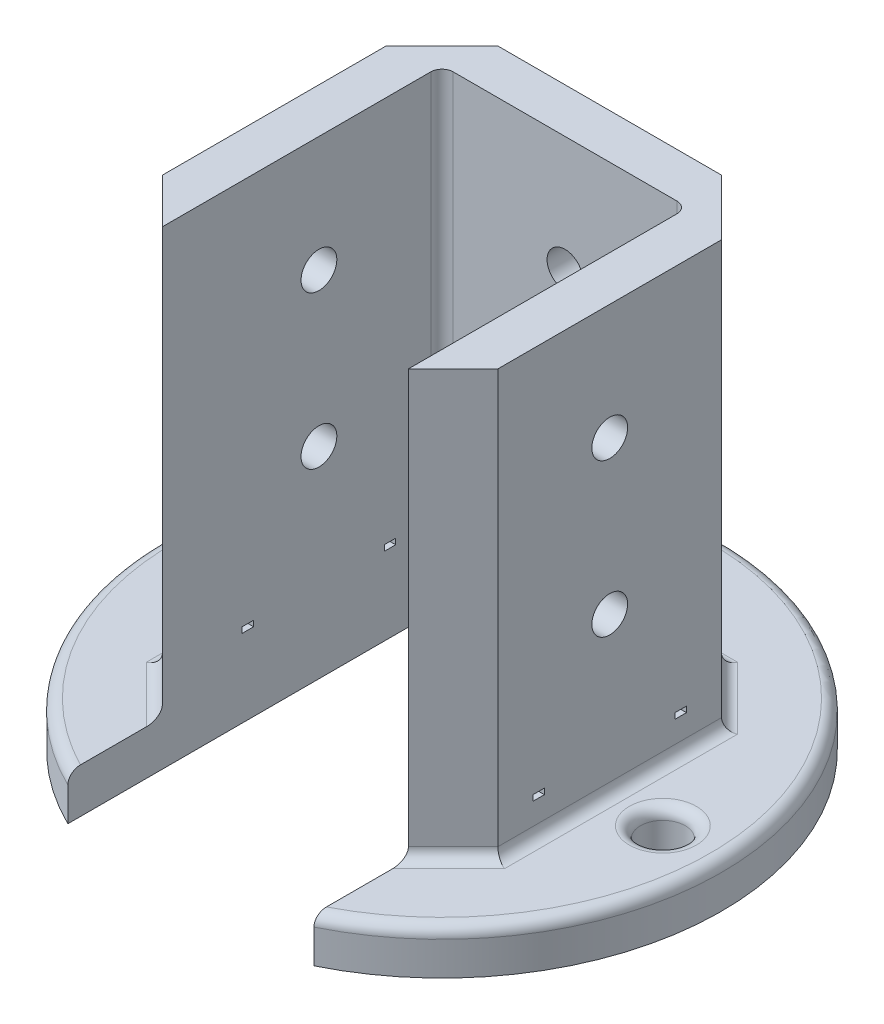
from build123d import *

# Parameters (mm, degrees)
SKETCH1_W               = 30
SKETCH1_H               = 30
BOSS_EXTRUDE1_DEPTH     = 62
SHELL1_T                = -4
SKETCH2_R               = 1.6
CUT_EXTRUDE1_DEPTH      = 62
SKETCH3_R               = 25
SKETCH3_R_2             = 2
SKETCH3_W               = 22
SKETCH3_H               = 22
BOSS_EXTRUDE2_DEPTH     = 4
CIRPATTERN1_COUNT       = 2
CIRPATTERN1_ANGLE       = 90
CHAMFER1_SIZE           = 5
FILLET1_R               = 1
FILLET2_R               = 1
SKETCH4_W               = 1.02
SKETCH4_H               = 0.51
CUT_EXTRUDE2_DEPTH      = 83.097503007
CIRPATTERN2_COUNT       = 2
CIRPATTERN2_ANGLE       = 90
SKETCH5_W               = 22
SKETCH5_H               = 14.914082391
CUT_EXTRUDE3_DEPTH      = 87.925255248
CUT_EXTRUDE4_DEPTH      = 84.928541203
CUT_EXTRUDE4_DEPTH_BACK = 84.928541203
SKETCH6_W               = 20
SKETCH6_H               = 15
SKETCH7_W               = 20
SKETCH7_H               = 15
CUT_EXTRUDE5_DEPTH      = 83.743569886
FILLET4_R               = 1
SKETCH8_W               = 39.694573315
SKETCH8_H               = 24
CUT_EXTRUDE6_DEPTH      = 84.928541203
FILLET5_R               = 1


with BuildPart() as part:
    # Sketch1 → Boss-Extrude1 (new body)
    with BuildSketch(Plane(origin=(0, 0, 0), x_dir=(1, 0, 0), z_dir=(0, 1, 0))):
        with Locations((15, 15)):
            Rectangle(SKETCH1_W, SKETCH1_H)
    extrude(amount=BOSS_EXTRUDE1_DEPTH)

    # Shell1
    shell1_openings = [part.faces().sort_by_distance(p)[0] for p in [
        (15, 62, -15),
        (15, 0, -15),
    ]]
    offset(amount=SHELL1_T, openings=shell1_openings, kind=Kind.INTERSECTION)

    # Sketch2 → Cut-Extrude1 (cut)
    with BuildSketch(Plane(origin=(30, 0, 0), x_dir=(0, 0, -1), z_dir=(1, 0, 0))):
        with Locations((15, 14)):
            Circle(SKETCH2_R)
        with Locations((15, 27.66)):
            Circle(SKETCH2_R)
    cut_extrude1 = extrude(amount=-CUT_EXTRUDE1_DEPTH, mode=Mode.SUBTRACT)

    # Sketch3 → Boss-Extrude2 (add)
    with BuildSketch(Plane.XZ):
        with Locations(Location((15, -15, 0), (0, 0, 270))):
            Circle(SKETCH3_R)
        with Locations(Location((34.75, -15, 0), (0, 0, 270))):
            Circle(SKETCH3_R_2, mode=Mode.SUBTRACT)
        with Locations(Location((15, -34.75, 0), (0, 0, 270))):
            Circle(SKETCH3_R_2, mode=Mode.SUBTRACT)
        with Locations(Location((-4.75, -15, 0), (0, 0, 270))):
            Circle(SKETCH3_R_2, mode=Mode.SUBTRACT)
        with Locations(Location((15, 4.75, 0), (0, 0, 270))):
            Circle(SKETCH3_R_2, mode=Mode.SUBTRACT)
        with Locations((15, -15)):
            Rectangle(SKETCH3_W, SKETCH3_H, mode=Mode.SUBTRACT)
    extrude(amount=BOSS_EXTRUDE2_DEPTH)

    # CirPattern1: Cut-Extrude1 ×2 about axis
    cirpattern1_axis = Axis((15, -4, -15), (0, 1, 0))
    for i in range(1, CIRPATTERN1_COUNT):
        add(cut_extrude1.rotate(cirpattern1_axis, i * CIRPATTERN1_ANGLE / (CIRPATTERN1_COUNT - 1)), mode=Mode.SUBTRACT)

    # Chamfer1
    chamfer1_edges = [part.edges().sort_by_distance(p)[0] for p in [
        (0, 31, -30),
        (30, 31, -30),
        (30, 31, 0),
        (0, 31, 0),
    ]]
    chamfer(chamfer1_edges, length=CHAMFER1_SIZE)

    # Fillet1
    # the kernel refuses this fillet: 1 mm, written as the material it takes off along each edge
    with BuildSketch(Plane(origin=(4, 62, -4), x_dir=(-1, 0, 0), z_dir=(0, 0, -1)), Plane(origin=(26, 62, -4), x_dir=(0, 0, 1), z_dir=(-1, 0, 0)), Plane(origin=(26, 62, -26), x_dir=(1, 0, 0), z_dir=(0, 0, 1)), Plane(origin=(4, 62, -26), x_dir=(0, 0, -1), z_dir=(1, 0, 0))) as fillet1_piece_1:
        with BuildLine():
            CenterArc((FILLET1_R, -FILLET1_R), FILLET1_R, 90, 90)
            Line((0, -FILLET1_R), (0, 0))
            Line((0, 0), (FILLET1_R, 0))
        make_face()
    extrude(amount=22, mode=Mode.SUBTRACT)
    with BuildSketch(Plane(origin=(2.5, 62, 0), x_dir=(0, -1, 0), z_dir=(1, 0, 0))) as fillet1_piece_2:
        with BuildLine():
            CenterArc((FILLET1_R, FILLET1_R), FILLET1_R, 180, 90)
            Line((0, FILLET1_R), (0, 0))
            Line((0, 0), (FILLET1_R, 0))
        make_face()
    extrude(amount=25, mode=Mode.SUBTRACT)
    with BuildSketch(Plane(origin=(0, 62, -27.5), x_dir=(1, 0, 0), z_dir=(0, 0, 1)), Plane(origin=(30, 62, -2.5), x_dir=(-1, 0, 0), z_dir=(0, 0, -1)), Plane(origin=(27.5, 62, -30), x_dir=(0, 0, 1), z_dir=(-1, 0, 0))) as fillet1_piece_3:
        with BuildLine():
            CenterArc((FILLET1_R, -FILLET1_R), FILLET1_R, 90, 90)
            Line((0, -FILLET1_R), (0, 0))
            Line((0, 0), (FILLET1_R, 0))
        make_face()
    extrude(amount=25, mode=Mode.SUBTRACT)
    with BuildSketch(Plane(origin=(-1.767766953, 62, -23.232233047), x_dir=(0.7071067811865476, 0, 0.7071067811865476), z_dir=(0.7071067811865476, 0, -0.7071067811865476)), Plane(origin=(23.232233047, 62, 1.767766953), x_dir=(0, -1, 0), z_dir=(0.7071067811865476, 0, -0.7071067811865476))) as fillet1_piece_4:
        with BuildLine():
            CenterArc((FILLET1_R, FILLET1_R), FILLET1_R, 180, 90)
            Line((0, FILLET1_R), (0, 0))
            Line((0, 0), (FILLET1_R, 0))
        make_face()
    extrude(amount=12.071067812, mode=Mode.SUBTRACT)
    with BuildSketch(Plane(origin=(31.767766953, 62, -23.232233047), x_dir=(-0.7071067811865476, 0, 0.7071067811865476), z_dir=(-0.7071067811865476, 0, -0.7071067811865476)), Plane(origin=(6.767766953, 62, 1.767766953), x_dir=(0, -1, 0), z_dir=(-0.7071067811865476, 0, -0.7071067811865476))) as fillet1_piece_5:
        with BuildLine():
            CenterArc((FILLET1_R, -FILLET1_R), FILLET1_R, 90, 90)
            Line((0, -FILLET1_R), (0, 0))
            Line((0, 0), (FILLET1_R, 0))
        make_face()
    extrude(amount=12.071067812, mode=Mode.SUBTRACT)
    with BuildSketch(Plane(origin=(26, 62, -4), x_dir=(0, 0, 1), z_dir=(-1, 0, 0))) as fillet1_piece_6a_section:
        with BuildLine():
            CenterArc((FILLET1_R, -FILLET1_R), FILLET1_R, 90, 90)
            Line((0, -FILLET1_R), (0, 0))
            Line((0, 0), (FILLET1_R, 0))
        make_face()
    fillet1_piece_6a = extrude(amount=24.5, mode=Mode.PRIVATE)
    fillet1_piece_6a = split(fillet1_piece_6a, bisect_by=Plane(origin=(4, 61.773604886, -3.773604886), z_dir=(-1, 0, 0)), keep=Keep.TOP, mode=Mode.PRIVATE)
    with BuildSketch(Plane(origin=(4, 62, -1.5), x_dir=(-1, 0, 0), z_dir=(0, 0, -1))) as fillet1_piece_6b_section:
        with BuildLine():
            CenterArc((FILLET1_R, -FILLET1_R), FILLET1_R, 90, 90)
            Line((0, -FILLET1_R), (0, 0))
            Line((0, 0), (FILLET1_R, 0))
        make_face()
    fillet1_piece_6b = extrude(amount=24.5, mode=Mode.PRIVATE)
    fillet1_piece_6b = split(fillet1_piece_6b, bisect_by=Plane(origin=(3.773604886, 61.773604886, -4), z_dir=(0, 0, 1)), keep=Keep.TOP, mode=Mode.PRIVATE)
    fillet1_piece_6 = fillet1_piece_6a & fillet1_piece_6b
    add(fillet1_piece_6, mode=Mode.SUBTRACT)
    with BuildSketch(Plane(origin=(4, 62, -4), x_dir=(-1, 0, 0), z_dir=(0, 0, -1))) as fillet1_piece_7a_section:
        with BuildLine():
            CenterArc((FILLET1_R, -FILLET1_R), FILLET1_R, 90, 90)
            Line((0, -FILLET1_R), (0, 0))
            Line((0, 0), (FILLET1_R, 0))
        make_face()
    fillet1_piece_7a = extrude(amount=24.5, mode=Mode.PRIVATE)
    fillet1_piece_7a = split(fillet1_piece_7a, bisect_by=Plane(origin=(3.773604886, 61.773604886, -26), z_dir=(0, 0, -1)), keep=Keep.TOP, mode=Mode.PRIVATE)
    with BuildSketch(Plane(origin=(1.5, 62, -26), x_dir=(0, 0, -1), z_dir=(1, 0, 0))) as fillet1_piece_7b_section:
        with BuildLine():
            CenterArc((FILLET1_R, -FILLET1_R), FILLET1_R, 90, 90)
            Line((0, -FILLET1_R), (0, 0))
            Line((0, 0), (FILLET1_R, 0))
        make_face()
    fillet1_piece_7b = extrude(amount=24.5, mode=Mode.PRIVATE)
    fillet1_piece_7b = split(fillet1_piece_7b, bisect_by=Plane(origin=(4, 61.773604886, -26.226395114), z_dir=(-1, 0, 0)), keep=Keep.TOP, mode=Mode.PRIVATE)
    fillet1_piece_7 = fillet1_piece_7a & fillet1_piece_7b
    add(fillet1_piece_7, mode=Mode.SUBTRACT)
    with BuildSketch(Plane(origin=(28.5, 62, -4), x_dir=(0, 0, 1), z_dir=(-1, 0, 0))) as fillet1_piece_8a_section:
        with BuildLine():
            CenterArc((FILLET1_R, -FILLET1_R), FILLET1_R, 90, 90)
            Line((0, -FILLET1_R), (0, 0))
            Line((0, 0), (FILLET1_R, 0))
        make_face()
    fillet1_piece_8a = extrude(amount=24.5, mode=Mode.PRIVATE)
    fillet1_piece_8a = split(fillet1_piece_8a, bisect_by=Plane(origin=(26, 61.773604886, -3.773604886), z_dir=(1, 0, 0)), keep=Keep.TOP, mode=Mode.PRIVATE)
    with BuildSketch(Plane(origin=(26, 62, -26), x_dir=(1, 0, 0), z_dir=(0, 0, 1))) as fillet1_piece_8b_section:
        with BuildLine():
            CenterArc((FILLET1_R, -FILLET1_R), FILLET1_R, 90, 90)
            Line((0, -FILLET1_R), (0, 0))
            Line((0, 0), (FILLET1_R, 0))
        make_face()
    fillet1_piece_8b = extrude(amount=24.5, mode=Mode.PRIVATE)
    fillet1_piece_8b = split(fillet1_piece_8b, bisect_by=Plane(origin=(26.226395114, 61.773604886, -4), z_dir=(0, 0, 1)), keep=Keep.TOP, mode=Mode.PRIVATE)
    fillet1_piece_8 = fillet1_piece_8a & fillet1_piece_8b
    add(fillet1_piece_8, mode=Mode.SUBTRACT)
    with BuildSketch(Plane(origin=(4, 62, -26), x_dir=(0, 0, -1), z_dir=(1, 0, 0))) as fillet1_piece_9a_section:
        with BuildLine():
            CenterArc((FILLET1_R, -FILLET1_R), FILLET1_R, 90, 90)
            Line((0, -FILLET1_R), (0, 0))
            Line((0, 0), (FILLET1_R, 0))
        make_face()
    fillet1_piece_9a = extrude(amount=24.5, mode=Mode.PRIVATE)
    fillet1_piece_9a = split(fillet1_piece_9a, bisect_by=Plane(origin=(26, 61.773604886, -26.226395114), z_dir=(1, 0, 0)), keep=Keep.TOP, mode=Mode.PRIVATE)
    with BuildSketch(Plane(origin=(26, 62, -28.5), x_dir=(1, 0, 0), z_dir=(0, 0, 1))) as fillet1_piece_9b_section:
        with BuildLine():
            CenterArc((FILLET1_R, -FILLET1_R), FILLET1_R, 90, 90)
            Line((0, -FILLET1_R), (0, 0))
            Line((0, 0), (FILLET1_R, 0))
        make_face()
    fillet1_piece_9b = extrude(amount=24.5, mode=Mode.PRIVATE)
    fillet1_piece_9b = split(fillet1_piece_9b, bisect_by=Plane(origin=(26.226395114, 61.773604886, -26), z_dir=(0, 0, -1)), keep=Keep.TOP, mode=Mode.PRIVATE)
    fillet1_piece_9 = fillet1_piece_9a & fillet1_piece_9b
    add(fillet1_piece_9, mode=Mode.SUBTRACT)

    # Fillet2
    fillet2_edges = [part.edges().sort_by_distance(p)[0] for p in [
        (34.75, 0, -13),
        (15, 0, -32.75),
        (-4.75, 0, -13),
        (15, 0, 6.75),
        (15, 0, 10),
        (15, 0, 0),
        (0, 0, -15),
        (30, 0, -15),
        (15, 0, -30),
        (2.5, 0, -2.5),
        (27.5, 0, -2.5),
        (27.5, 0, -27.5),
        (2.5, 0, -27.5),
    ]]
    fillet(fillet2_edges, radius=FILLET2_R)

    # Sketch4 → Cut-Extrude2 (cut, symmetric)
    with BuildSketch(Plane(origin=(4, 0, 0), x_dir=(0, 0, -1), z_dir=(1, 0, 0))):
        with Locations((8.65, 3.205)):
            Rectangle(SKETCH4_W, SKETCH4_H)
        with Locations((21.35, 3.205)):
            Rectangle(SKETCH4_W, SKETCH4_H)
    cut_extrude2 = extrude(amount=CUT_EXTRUDE2_DEPTH, both=True, mode=Mode.SUBTRACT)

    # CirPattern2: Cut-Extrude2 ×2 about axis
    cirpattern2_axis = Axis((15, -4, -15), (0, -1, 0))
    for i in range(1, CIRPATTERN2_COUNT):
        add(cut_extrude2.rotate(cirpattern2_axis, i * CIRPATTERN2_ANGLE / (CIRPATTERN2_COUNT - 1)), mode=Mode.SUBTRACT)

    # Sketch5 → Cut-Extrude3 (cut, through all)
    with BuildSketch(Plane(origin=(0, 62, 0), x_dir=(1, 0, 0), z_dir=(0, 1, 0))):
        with Locations((15, -3.457041196)):
            Rectangle(SKETCH5_W, SKETCH5_H)
    extrude(amount=-CUT_EXTRUDE3_DEPTH, mode=Mode.SUBTRACT)

    # Sketch6 → Cut-Extrude4 (cut, two sides: drawn at the far end of the back side and taken through both)
    with BuildSketch(Plane.ZY.offset(-CUT_EXTRUDE4_DEPTH_BACK)):
        with Locations((-15, 50.5)):
            Rectangle(SKETCH6_W, SKETCH6_H)
    extrude(amount=CUT_EXTRUDE4_DEPTH + CUT_EXTRUDE4_DEPTH_BACK, mode=Mode.SUBTRACT)

    # Sketch7 → Cut-Extrude5 (cut, through all)
    with BuildSketch(Plane(origin=(0, 0, -30), x_dir=(-1, 0, 0), z_dir=(0, 0, -1))):
        with Locations((-15, 50.5)):
            Rectangle(SKETCH7_W, SKETCH7_H)
    extrude(amount=-CUT_EXTRUDE5_DEPTH, mode=Mode.SUBTRACT)

    # Fillet4
    fillet4_edges = [part.edges().sort_by_distance(p)[0] for p in [
        (2, 58, -25),
        (28, 58, -25),
        (2, 43, -5),
        (28, 43, -5),
        (2, 58, -5),
        (2, 43, -25),
        (28, 43, -25),
        (28, 58, -5),
        (25, 43, -28),
        (25, 58, -28),
        (5, 58, -28),
        (5, 43, -28),
    ]]
    fillet(fillet4_edges, radius=FILLET4_R)

    # Sketch8 → Cut-Extrude6 (cut, through all)
    with BuildSketch(Plane.ZY):
        with Locations((-14.809156122, 50)):
            Rectangle(SKETCH8_W, SKETCH8_H)
    extrude(amount=-CUT_EXTRUDE6_DEPTH, mode=Mode.SUBTRACT)

    # Fillet5
    fillet5_edges = [part.edges().sort_by_distance(p)[0] for p in [
        (26, 17, -26),
        (4, 17, -26),
    ]]
    fillet(fillet5_edges, radius=FILLET5_R)


solid = part.part
